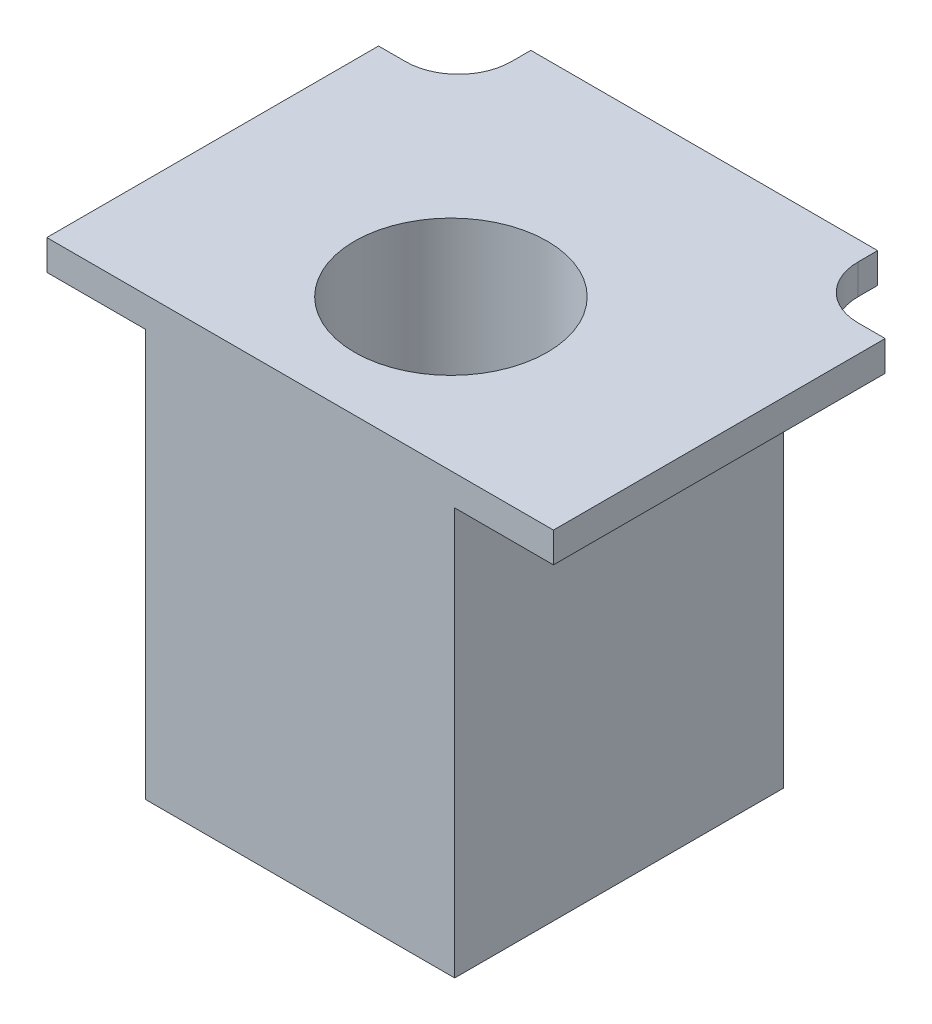
from build123d import *

# Parameters (mm, degrees)
SKETCH1_W           = 10.25
SKETCH1_H           = 10.9
BOSS_EXTRUDE1_DEPTH = 1.5
SKETCH2_W           = 6.39
SKETCH2_H           = 8.4
CUT_EXTRUDE1_DEPTH  = 8.630080275
SKETCH3_W           = 10.25
SKETCH3_H           = 10.9
SKETCH3_R           = 3.195
BOSS_EXTRUDE2_DEPTH = 13
BOSS_EXTRUDE3_DEPTH = 1


with BuildPart() as part:
    # Sketch1 → Boss-Extrude1 (new body)
    with BuildSketch(Plane(origin=(0, 0, 0), x_dir=(1, 0, 0), z_dir=(0, 1, 0))):
        Rectangle(SKETCH1_W, SKETCH1_H)
    extrude(amount=BOSS_EXTRUDE1_DEPTH)

    # Sketch2 → Cut-Extrude1 (cut, through all)
    with BuildSketch(Plane(origin=(0, 1.5, 0), x_dir=(1, 0, 0), z_dir=(0, 1, 0))):
        with Locations((0, -0.45)):
            Rectangle(SKETCH2_W, SKETCH2_H)
    extrude(amount=-CUT_EXTRUDE1_DEPTH, mode=Mode.SUBTRACT)

    # Sketch3 → Boss-Extrude2 (add)
    with BuildSketch(Plane(origin=(0, 1.5, 0), x_dir=(1, 0, 0), z_dir=(0, 1, 0))):
        Rectangle(SKETCH3_W, SKETCH3_H)
        with Locations((0, -0.45)):
            Circle(SKETCH3_R, mode=Mode.SUBTRACT)
    extrude(amount=BOSS_EXTRUDE2_DEPTH)

    # Sketch5 → Boss-Extrude3 (add)
    with BuildSketch(Plane(origin=(0, 14.5, 0), x_dir=(1, 0, 0), z_dir=(0, 1, 0))):
        with BuildLine():
            Line((-5.75, 7.95), (-5.75, 7.3))
            ThreePointArc((-5.75, 7.3), (-6.262563133, 6.062563133), (-7.5, 5.55))
            Line((-7.5, 5.55), (-8.4, 5.55))
            Line((-8.4, 5.55), (-8.4, -5.45))
            Line((-8.4, -5.45), (-5.125, -5.45))
            Line((-5.125, -5.45), (-5.125, 5.45))
            Line((-5.125, 5.45), (5.125, 5.45))
            Line((5.125, 5.45), (5.125, -5.45))
            Line((5.125, -5.45), (8.4, -5.45))
            Line((8.4, -5.45), (8.4, 5.55))
            Line((8.4, 5.55), (7.5, 5.55))
            ThreePointArc((7.5, 5.55), (6.262563133, 6.062563133), (5.75, 7.3))
            Line((5.75, 7.3), (5.75, 7.95))
            Line((5.75, 7.95), (-5.75, 7.95))
        make_face()
    extrude(amount=-BOSS_EXTRUDE3_DEPTH)


solid = part.part
